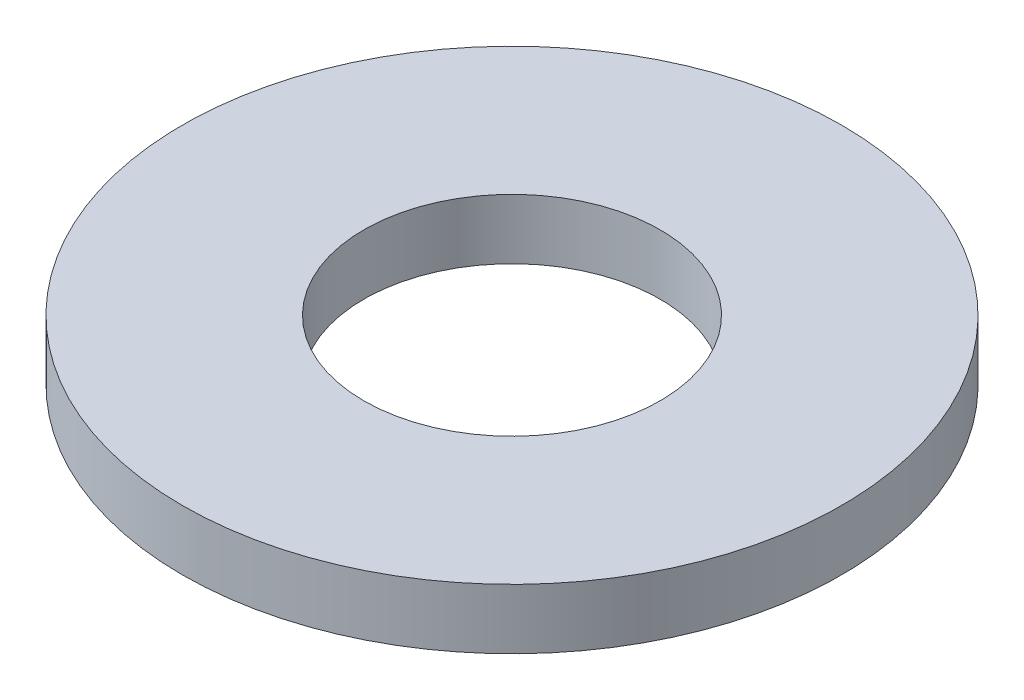
from build123d import *

# Parameters (mm, degrees)
SKETCH1_R           = 7.9375
BOSS_EXTRUDE1_DEPTH = 1.4478
SKETCH5_R           = 3.5687
CUT_EXTRUDE1_DEPTH  = 12.318300992


with BuildPart() as part:
    # Sketch1 → Boss-Extrude1 (new body)
    with BuildSketch(Plane(origin=(0, 0, 0), x_dir=(1, 0, 0), z_dir=(0, 1, 0))):
        Circle(SKETCH1_R)
    extrude(amount=BOSS_EXTRUDE1_DEPTH)

    # Sketch5 → Cut-Extrude1 (cut, through all)
    with BuildSketch(Plane(origin=(0, 1.4478, 0), x_dir=(-1, 0, 0), z_dir=(0, 1, 0))):
        Circle(SKETCH5_R)
    extrude(amount=-CUT_EXTRUDE1_DEPTH, mode=Mode.SUBTRACT)


solid = part.part
